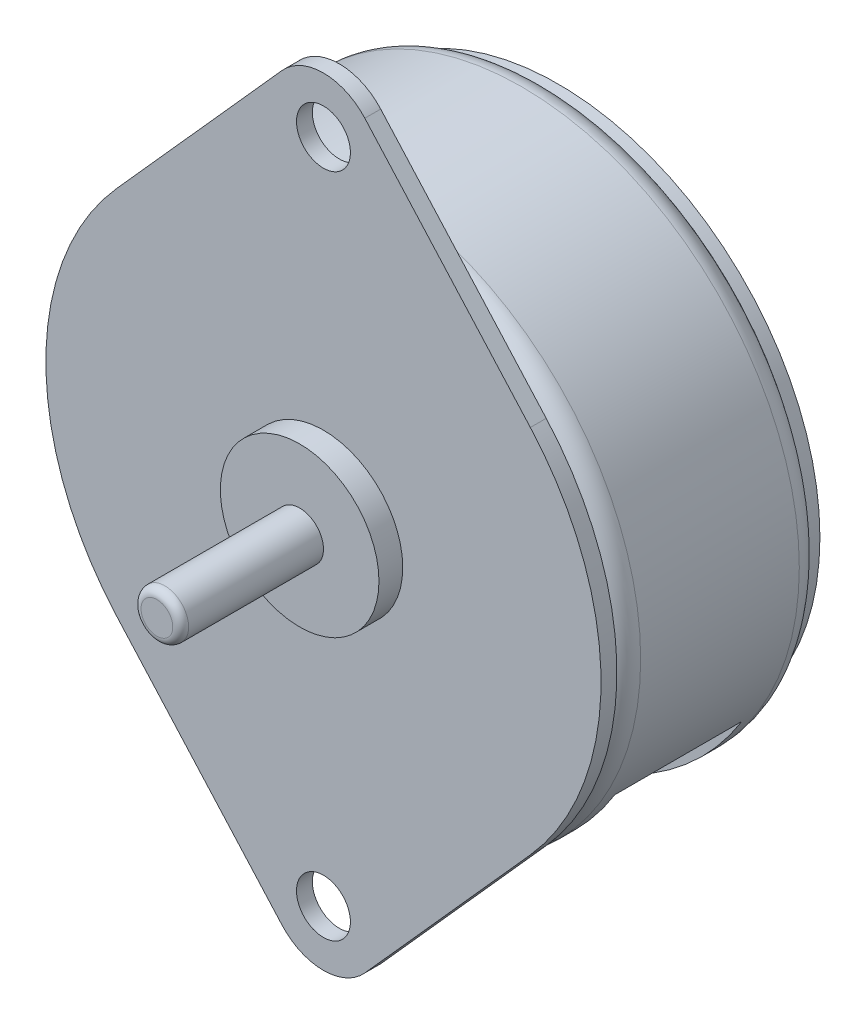
from build123d import *

# Parameters (mm, degrees)
SKETCH1_R           = 1.7
BOSS_EXTRUDE1_DEPTH = 1
SKETCH2_R           = 17.5
BOSS_EXTRUDE2_DEPTH = 13
FILLET4_R           = 1.5
SKETCH3_R           = 16.5
BOSS_EXTRUDE3_DEPTH = 0.8
SKETCH4_R           = 5
BOSS_EXTRUDE4_DEPTH = 1.5
SKETCH6_R           = 1.5
BOSS_EXTRUDE5_DEPTH = 9
FILLET2_R           = 0.5
SKETCH8_R           = 3
BOSS_EXTRUDE6_DEPTH = 0.5
BOSS_EXTRUDE7_START = 1
SKETCH9_R           = 1.5
BOSS_EXTRUDE7_DEPTH = 1
FILLET3_R           = 0.5
SURFACECUT1_START   = -10.5
SURFACECUT1_DEPTH   = 8


# Read off the part's stored shape, not the designer's step: SurfaceCut1
with BuildPart() as part:
    # Sketch1 → Boss-Extrude1 (new body)
    with BuildSketch(Plane.XY):
        with BuildLine():
            Line((-13.043729869, 11.666666667), (-2.608745974, 23.333333333))
            ThreePointArc((-2.608745974, 23.333333333), (0, 24.5), (2.608745974, 23.333333333))
            Line((2.608745974, 23.333333333), (13.043729869, 11.666666667))
            ThreePointArc((13.043729869, 11.666666667), (17.5, 0), (13.043729869, -11.666666667))
            Line((13.043729869, -11.666666667), (2.608745974, -23.333333333))
            ThreePointArc((2.608745974, -23.333333333), (0, -24.5), (-2.608745974, -23.333333333))
            Line((-2.608745974, -23.333333333), (-13.043729869, -11.666666667))
            ThreePointArc((-13.043729869, -11.666666667), (-17.5, 0), (-13.043729869, 11.666666667))
        make_face()
        with Locations((0, 21)):
            Circle(SKETCH1_R, mode=Mode.SUBTRACT)
        with Locations((0, -21)):
            Circle(SKETCH1_R, mode=Mode.SUBTRACT)
    extrude(amount=BOSS_EXTRUDE1_DEPTH)


with BuildPart() as body_2:
    # Sketch2 → Boss-Extrude2 (new body)
    with BuildSketch(Plane(origin=(0, 0, 0), x_dir=(-1, 0, 0), z_dir=(0, 0, -1))):
        with Locations(Location((0, 0, 0), (0, 0, 180))):
            Circle(SKETCH2_R)
    extrude(amount=BOSS_EXTRUDE2_DEPTH)

    # Fillet4
    fillet4_edges = [body_2.edges().sort_by_distance(p)[0] for p in [
        (-17.5, 0, 0),
        (-17.5, 0, -13),
    ]]
    fillet(fillet4_edges, radius=FILLET4_R)


with BuildPart() as part_1:
    add(part.part)

    # Combine1: union body 2
    add(body_2.part)

    # Sketch3 → Boss-Extrude3 (add)
    with BuildSketch(Plane(origin=(0, 0, -13), x_dir=(-1, 0, 0), z_dir=(0, 0, -1))):
        Circle(SKETCH3_R)
    extrude(amount=BOSS_EXTRUDE3_DEPTH)

    # Sketch4 → Boss-Extrude4 (add)
    with BuildSketch(Plane.XY.offset(1)):
        Circle(SKETCH4_R)
    extrude(amount=BOSS_EXTRUDE4_DEPTH)

    # Sketch6 → Boss-Extrude5 (add)
    with BuildSketch(Plane.XY.offset(2.5)):
        Circle(SKETCH6_R)
    extrude(amount=BOSS_EXTRUDE5_DEPTH)

    # Fillet2
    fillet2_edges = [part_1.edges().sort_by_distance(p)[0] for p in [
        (-1.5, 0, 11.5),
    ]]
    fillet(fillet2_edges, radius=FILLET2_R)

    # Sketch8 → Boss-Extrude6 (add)
    with BuildSketch(Plane(origin=(0, 0, -13.8), x_dir=(-1, 0, 0), z_dir=(0, 0, -1))):
        Circle(SKETCH8_R)
    extrude(amount=BOSS_EXTRUDE6_DEPTH)

    # Sketch9 → Boss-Extrude7 (add)
    with BuildSketch(Plane(origin=(0, 0, -14.3), x_dir=(-1, 0, 0), z_dir=(0, 0, -1)).offset(BOSS_EXTRUDE7_START)):
        with Locations(Location((0, 0, 0), (0, 0, 180))):
            Circle(SKETCH9_R)
    extrude(amount=-BOSS_EXTRUDE7_DEPTH)

    # Fillet3
    fillet3_edges = [part_1.edges().sort_by_distance(p)[0] for p in [
        (-1.5, 0, -15.3),
    ]]
    fillet(fillet3_edges, radius=FILLET3_R)

    # SurfaceCut1 outline → SurfaceCut1 (cut)
    with BuildSketch(Plane.XY.offset(SURFACECUT1_START)):
        with BuildLine():
            Line((8.126024025, -13.782878275), (9.218356678, -14.875210928))
            ThreePointArc((9.218356678, -14.875210928), (12.374368671, -12.374368671), (14.875210928, -9.218356678))
            Line((14.875210928, -9.218356678), (13.782878275, -8.126024025))
            ThreePointArc((13.782878275, -8.126024025), (11.313708499, -11.313708499), (8.126024025, -13.782878275))
        make_face()
    extrude(amount=SURFACECUT1_DEPTH, mode=Mode.SUBTRACT)


solid = part_1.part
